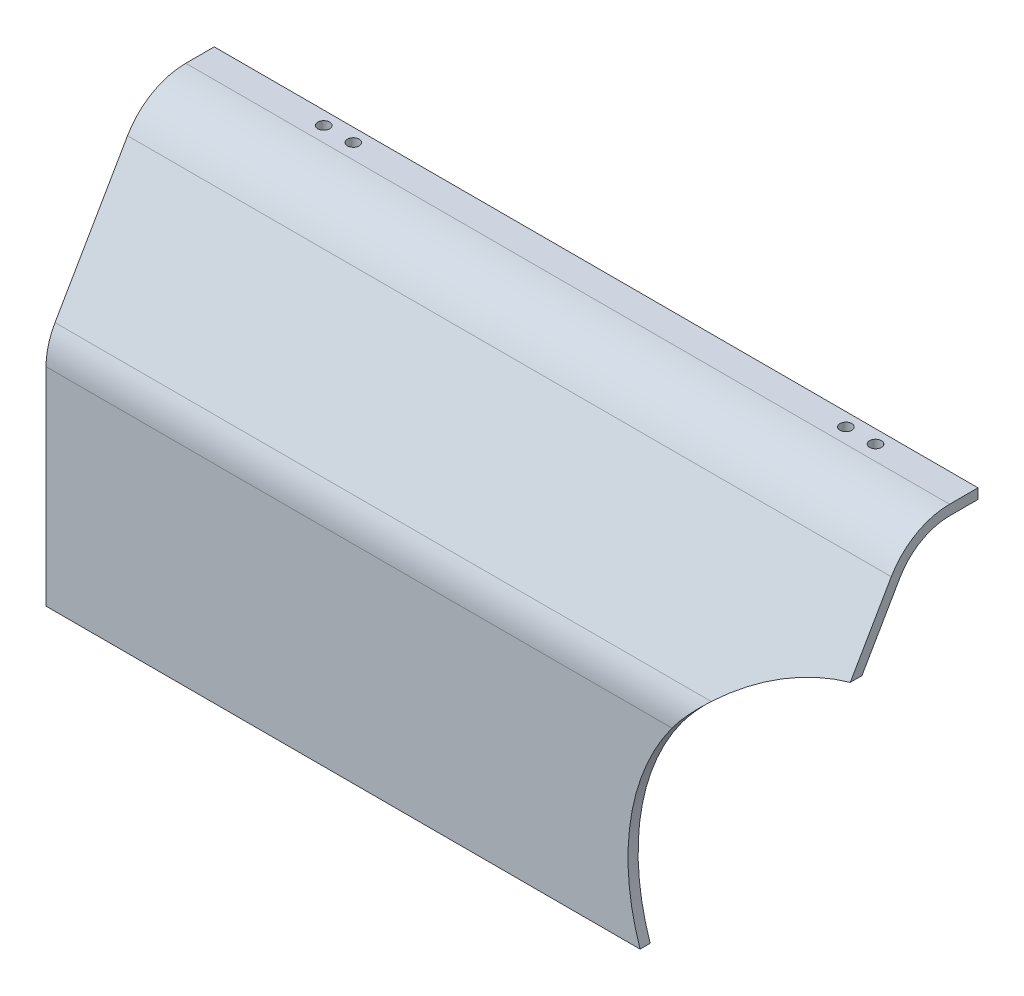
from build123d import *

# Parameters (mm, degrees)
SALIENTE_EXTRUIR1_DEPTH = 113.5
REDONDEO1_R             = 20
REDONDEO2_R             = 20
REDONDEO3_R             = 17
REDONDEO4_R             = 17
CROQUIS4_R              = 1.75
CORTAR_EXTRUIR3_DEPTH   = 4
CROQUIS5_R              = 1.75
CORTAR_EXTRUIR4_DEPTH   = 4
CROQUIS7_R              = 67.5
CORTAR_EXTRUIR6_DEPTH   = 172.854863901


with BuildPart() as part:
    # Croquis1 → Saliente-Extruir1 (new, symmetric)
    with BuildSketch(Plane(origin=(0, 0, 0), x_dir=(0, 0, -1), z_dir=(1, 0, 0))):
        Polygon((0, 0), (0, 66.196152423), (28.732050808, 115.961524227), (47, 115.961524227), (47, 118.961524227), (27, 118.961524227), (-3, 67), (-3, 0), align=None)
    extrude(amount=SALIENTE_EXTRUIR1_DEPTH, both=True)

    # Redondeo1
    redondeo1_edges = [part.edges().sort_by_distance(p)[0] for p in [
        (0, 67, 3),
    ]]
    fillet(redondeo1_edges, radius=REDONDEO1_R)

    # Redondeo2
    redondeo2_edges = [part.edges().sort_by_distance(p)[0] for p in [
        (0, 118.961524227, -27),
    ]]
    fillet(redondeo2_edges, radius=REDONDEO2_R)

    # Redondeo3
    redondeo3_edges = [part.edges().sort_by_distance(p)[0] for p in [
        (0, 115.961524227, -28.732050808),
    ]]
    fillet(redondeo3_edges, radius=REDONDEO3_R)

    # Redondeo4
    redondeo4_edges = [part.edges().sort_by_distance(p)[0] for p in [
        (0, 66.196152423, 0),
    ]]
    fillet(redondeo4_edges, radius=REDONDEO4_R)

    # Croquis4 → Cortar-Extruir3 (cut)
    with BuildSketch(Plane(origin=(0, 118.961524227, 0), x_dir=(1, 0, 0), z_dir=(0, 1, 0))):
        with Locations((-77, 43.047005384)):
            Circle(CROQUIS4_R)
        with Locations((-68.2, 43.047005384)):
            Circle(CROQUIS4_R)
    extrude(amount=-CORTAR_EXTRUIR3_DEPTH, mode=Mode.SUBTRACT)

    # Croquis5 → Cortar-Extruir4 (cut)
    with BuildSketch(Plane(origin=(0, 118.961524227, 0), x_dir=(1, 0, 0), z_dir=(0, 1, 0))):
        with Locations((78.2, 43.047005384)):
            Circle(CROQUIS5_R)
        with Locations((87, 43.047005384)):
            Circle(CROQUIS5_R)
    extrude(amount=-CORTAR_EXTRUIR4_DEPTH, mode=Mode.SUBTRACT)

    # Croquis7 → Cortar-Extruir6 (cut, through all)
    with BuildSketch(Plane.XY.offset(3)):
        with Locations((126.978079309, 21.721524227)):
            Circle(CROQUIS7_R)
    extrude(amount=-CORTAR_EXTRUIR6_DEPTH, mode=Mode.SUBTRACT)


solid = part.part
